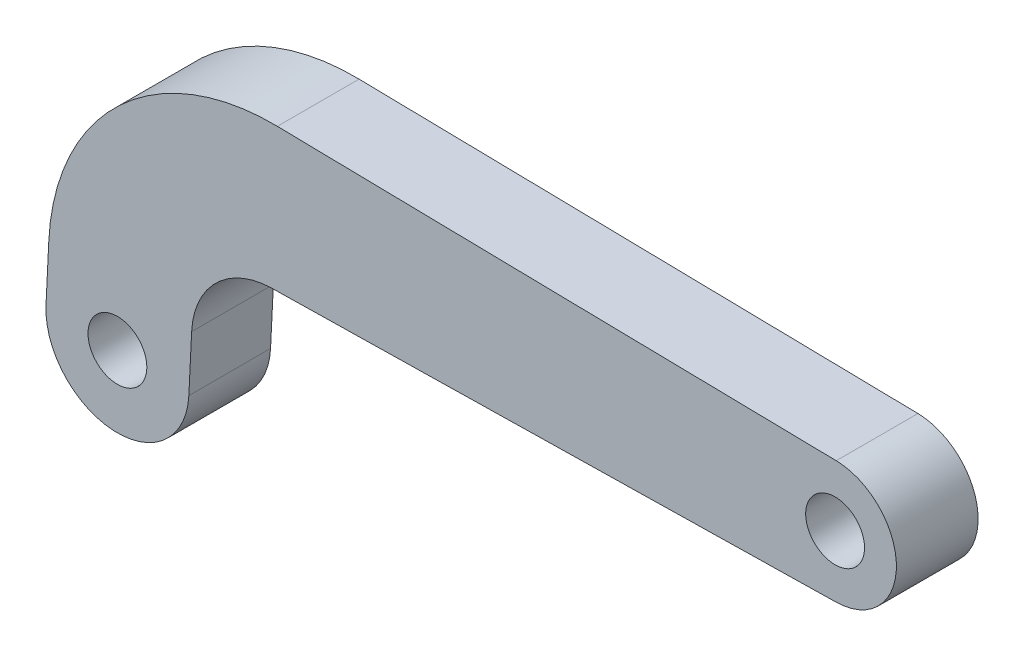
from build123d import *

# Parameters (mm, degrees)
SKETCH1_R           = 2.286
BOSS_EXTRUDE1_DEPTH = 3.175


with BuildPart() as part:
    # Sketch1 → Boss-Extrude1 (new, symmetric)
    with BuildSketch(Plane.XY):
        with BuildLine():
            Line((55.852160303, 20.499543888), (12.426339018, 21.289226167))
            ThreePointArc((12.426339018, 21.289226167), (0.183355577, 16.585853064), (-5.332604413, 4.686838505))
            Line((-5.332604413, 4.686838505), (-5.549551288, 0.272753664))
            ThreePointArc((-5.549551288, 0.272753664), (-0.272753664, -5.549551288), (5.549551288, -0.272753664))
            Line((5.549551288, -0.272753664), (5.766498164, 4.141331178))
            ThreePointArc((5.766498164, 4.141331178), (7.688680768, 8.388633469), (11.993389211, 10.178563055))
            Line((11.993389211, 10.178563055), (55.852160303, 10.976118364))
            ThreePointArc((55.852160303, 10.976118364), (60.528070342, 15.737831126), (55.852160303, 20.499543888))
        make_face()
        Circle(SKETCH1_R, mode=Mode.SUBTRACT)
        with Locations((55.765570342, 15.737831126)):
            Circle(SKETCH1_R, mode=Mode.SUBTRACT)
    extrude(amount=BOSS_EXTRUDE1_DEPTH, both=True)


solid = part.part
